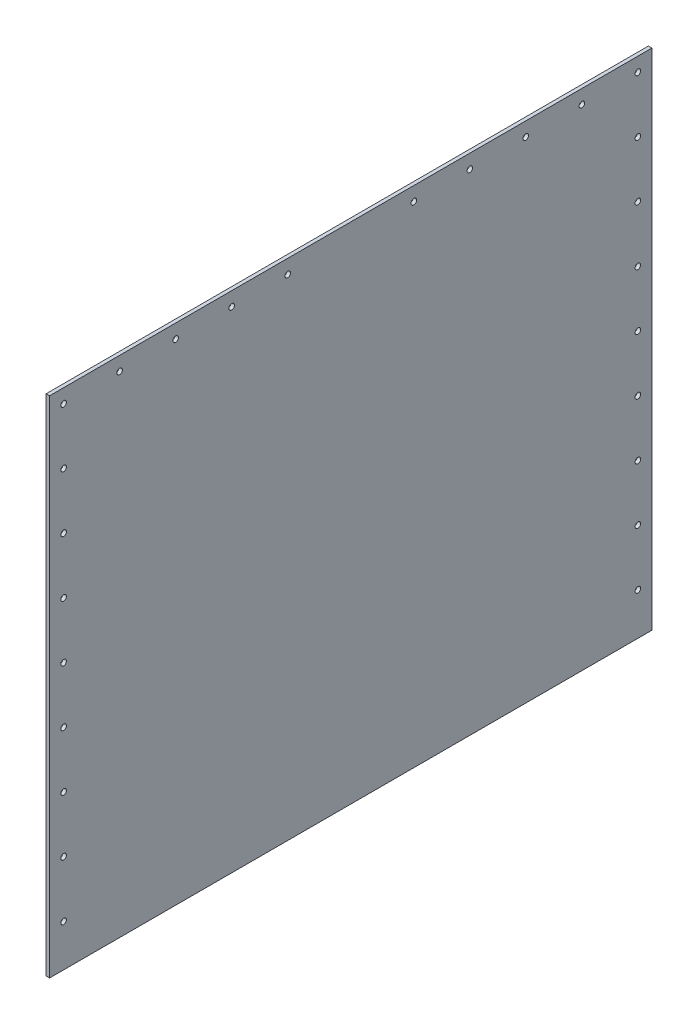
from build123d import *

# Parameters (mm, degrees)
SKETCH1_W           = 546.1
SKETCH1_H           = 457.2
BOSS_EXTRUDE1_DEPTH = 3.175
SKETCH2_R           = 2.54
CUT_EXTRUDE1_DEPTH  = 713.226881425


with BuildPart() as part:
    # Sketch1 → Boss-Extrude1 (new body)
    with BuildSketch(Plane(origin=(0, 0, 0), x_dir=(0, 0, -1), z_dir=(1, 0, 0))):
        with Locations((273.05, 228.6)):
            Rectangle(SKETCH1_W, SKETCH1_H)
    extrude(amount=BOSS_EXTRUDE1_DEPTH)

    # Sketch2 → Cut-Extrude1 (cut, through all)
    with BuildSketch(Plane(origin=(3.175, 0, 0), x_dir=(0, 0, -1), z_dir=(1, 0, 0))):
        with Locations((12.7, 444.5)):
            Circle(SKETCH2_R)
        with Locations((63.5, 444.5)):
            Circle(SKETCH2_R)
        with Locations((114.3, 444.5)):
            Circle(SKETCH2_R)
        with Locations((165.1, 444.5)):
            Circle(SKETCH2_R)
        with Locations((215.9, 444.5)):
            Circle(SKETCH2_R)
        with Locations((12.7, 393.7)):
            Circle(SKETCH2_R)
        with Locations((12.7, 342.9)):
            Circle(SKETCH2_R)
        with Locations((12.7, 292.1)):
            Circle(SKETCH2_R)
        with Locations((12.7, 241.3)):
            Circle(SKETCH2_R)
        with Locations((12.7, 190.5)):
            Circle(SKETCH2_R)
        with Locations((12.7, 139.7)):
            Circle(SKETCH2_R)
        with Locations((12.7, 88.9)):
            Circle(SKETCH2_R)
        with Locations((12.7, 38.1)):
            Circle(SKETCH2_R)
        with Locations((533.4, 38.1)):
            Circle(SKETCH2_R)
        with Locations((533.4, 88.9)):
            Circle(SKETCH2_R)
        with Locations((533.4, 139.7)):
            Circle(SKETCH2_R)
        with Locations((533.4, 190.5)):
            Circle(SKETCH2_R)
        with Locations((533.4, 241.3)):
            Circle(SKETCH2_R)
        with Locations((533.4, 292.1)):
            Circle(SKETCH2_R)
        with Locations((533.4, 342.9)):
            Circle(SKETCH2_R)
        with Locations((533.4, 393.7)):
            Circle(SKETCH2_R)
        with Locations((330.2, 444.5)):
            Circle(SKETCH2_R)
        with Locations((381, 444.5)):
            Circle(SKETCH2_R)
        with Locations((431.8, 444.5)):
            Circle(SKETCH2_R)
        with Locations((482.6, 444.5)):
            Circle(SKETCH2_R)
        with Locations((533.4, 444.5)):
            Circle(SKETCH2_R)
    extrude(amount=-CUT_EXTRUDE1_DEPTH, mode=Mode.SUBTRACT)


solid = part.part
